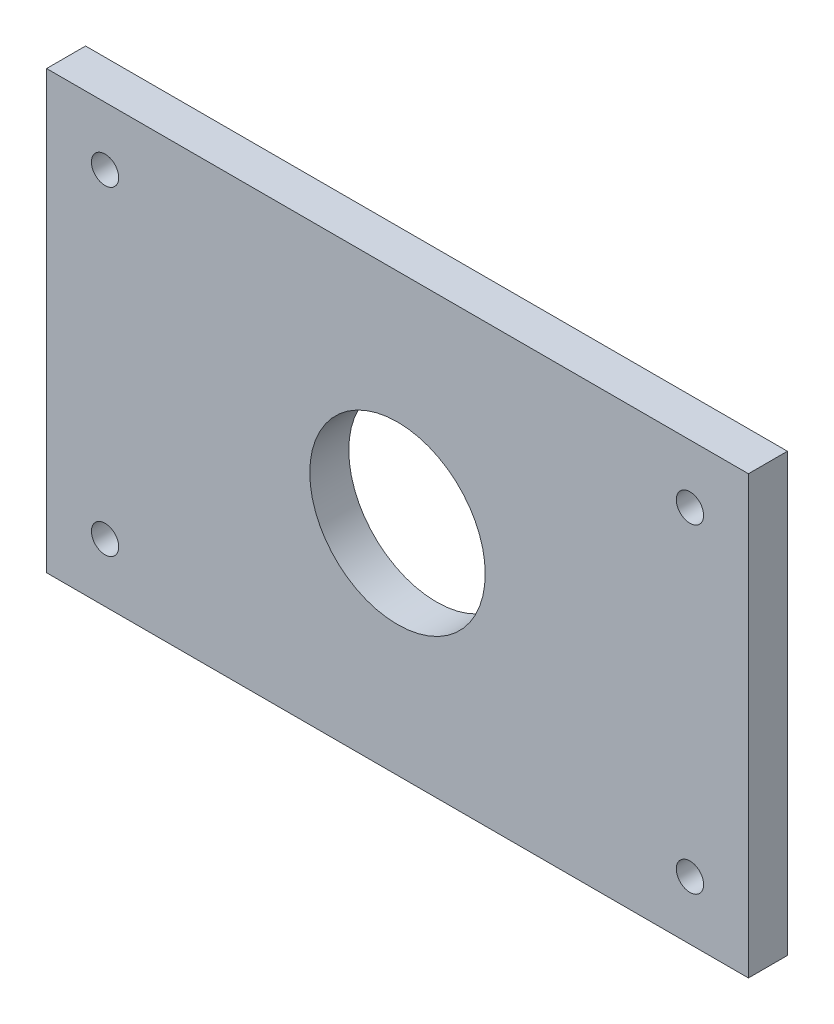
from build123d import *

# Parameters (mm, degrees)
SKETCH_1_W          = 90
SKETCH_1_H          = 56
SKETCH_1_R          = 1.75
EXTRUDE_1_DEPTH     = 5
SKETCH_2_R          = 11.25
CUT_EXTRUDE_1_DEPTH = 5


with BuildPart() as part:
    # ｽｹｯﾁ1 → ﾎﾞｽ - 押し出し1 (new body)
    with BuildSketch(Plane.XY):
        Rectangle(SKETCH_1_W, SKETCH_1_H)
        with Locations((-37.5, 20.5)):
            Circle(SKETCH_1_R, mode=Mode.SUBTRACT)
        with Locations((37.5, 20.5)):
            Circle(SKETCH_1_R, mode=Mode.SUBTRACT)
        with Locations((37.5, -20.5)):
            Circle(SKETCH_1_R, mode=Mode.SUBTRACT)
        with Locations((-37.5, -20.5)):
            Circle(SKETCH_1_R, mode=Mode.SUBTRACT)
    extrude(amount=EXTRUDE_1_DEPTH)

    # ｽｹｯﾁ2 → ｶｯﾄ - 押し出し1 (cut)
    with BuildSketch(Plane.XY.offset(5)):
        Circle(SKETCH_2_R)
    extrude(amount=-CUT_EXTRUDE_1_DEPTH, mode=Mode.SUBTRACT)


solid = part.part
